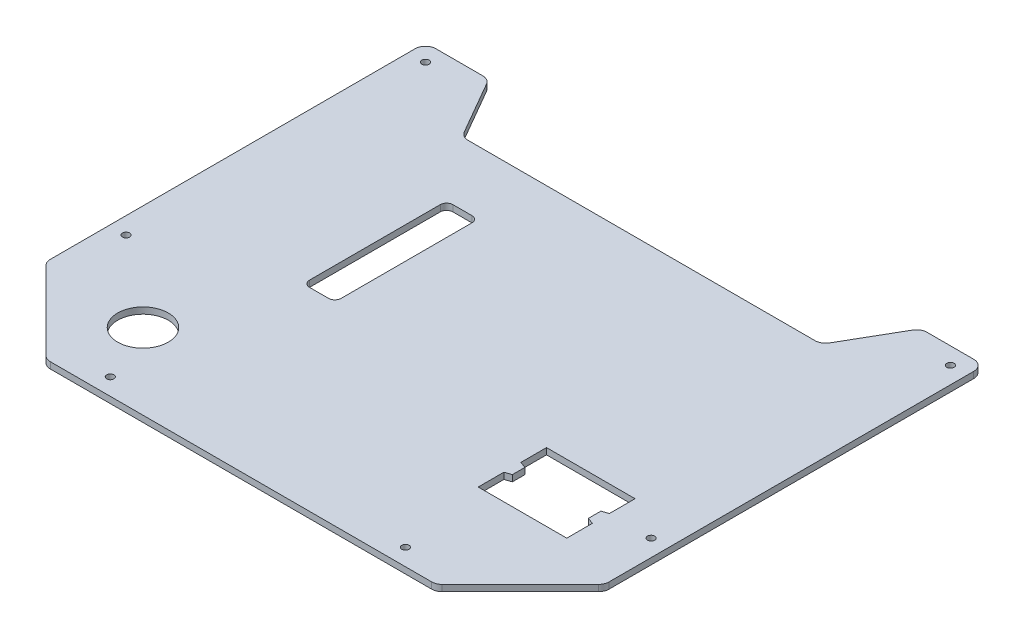
from build123d import *

# Parameters (mm, degrees)
BOSS_EXTRU_1_DEPTH      = 3
CONG_1_R                = 5
ESQUISSE2_R             = 1
ENL_V_MAT_EXTRU_1_DEPTH = 257.837010573
D_GAGEMENT_M31_D        = 3.4
ESQUISSE5_R             = 12
ESQUISSE5_W             = 15
ESQUISSE5_H             = 68
ENL_V_MAT_EXTRU_2_DEPTH = 257.837010573
CONG_2_R                = 3


with BuildPart() as part:
    # Esquisse1 → Boss.-Extru.1 (new body)
    with BuildSketch(Plane(origin=(0, 0, 0), x_dir=(1, 0, 0), z_dir=(0, 1, 0))):
        Polygon((-92.5, 0), (92.5, 0), (132.5, 40), (132.5, 220), (102.5, 220), (85.179491924, 190), (-85.179491924, 190), (-102.5, 220), (-132.5, 220), (-132.5, 40), align=None)
    extrude(amount=BOSS_EXTRU_1_DEPTH)

    # Congé1
    cong_1_edges = [part.edges().sort_by_distance(p)[0] for p in [
        (132.5, 1.5, -220),
        (102.5, 1.5, -220),
        (85.179491924, 1.5, -190),
        (-85.179491924, 1.5, -190),
        (-102.5, 1.5, -220),
        (-132.5, 1.5, -220),
        (-132.5, 1.5, -40),
        (-92.5, 1.5, 0),
        (92.5, 1.5, 0),
        (132.5, 1.5, -40),
    ]]
    fillet(cong_1_edges, radius=CONG_1_R)

    # Esquisse2 → Enlèv. mat.-Extru.1 (cut, through all)
    with BuildSketch(Plane.XZ):
        with Locations((-70, -8)):
            Circle(ESQUISSE2_R)
        with Locations((-124.5, -70)):
            Circle(ESQUISSE2_R)
        with Locations((-124.5, -212)):
            Circle(ESQUISSE2_R)
        with Locations((124.5, -212)):
            Circle(ESQUISSE2_R)
        with Locations((124.5, -70)):
            Circle(ESQUISSE2_R)
        with Locations((70, -8)):
            Circle(ESQUISSE2_R)
    extrude(amount=-ENL_V_MAT_EXTRU_1_DEPTH, mode=Mode.SUBTRACT)

    # Dégagement M31 (through all)
    with Locations(Plane(origin=(0, 0, 0), x_dir=(-1, 0, 0), z_dir=(0, -1, 0))):
        with Locations((-70, 8), (-124.5, 70), (-124.5, 212), (124.5, 212), (124.5, 70), (70, 8)):
            Hole(D_GAGEMENT_M31_D / 2)

    # Esquisse5 → Enlèv. mat.-Extru.2 (cut, through all)
    with BuildSketch(Plane.XZ):
        with Locations((-82.5, -36)):
            Circle(ESQUISSE5_R)
        Polygon((104.5, -50), (62.5, -50), (62.5, -62.2), (65.5, -63.2), (65.5, -69.2), (62.5, -70.2), (62.5, -82.4), (104.5, -82.4), (104.5, -70.2), (101.5, -69.2), (101.5, -63.2), (104.5, -62.2), align=None)
        with Locations((-55, -126)):
            Rectangle(ESQUISSE5_W, ESQUISSE5_H)
    extrude(amount=-ENL_V_MAT_EXTRU_2_DEPTH, mode=Mode.SUBTRACT)

    # Congé2
    cong_2_edges = [part.edges().sort_by_distance(p)[0] for p in [
        (-62.5, 1.5, -92),
        (-47.5, 1.5, -92),
        (-47.5, 1.5, -160),
        (-62.5, 1.5, -160),
    ]]
    fillet(cong_2_edges, radius=CONG_2_R)


solid = part.part
